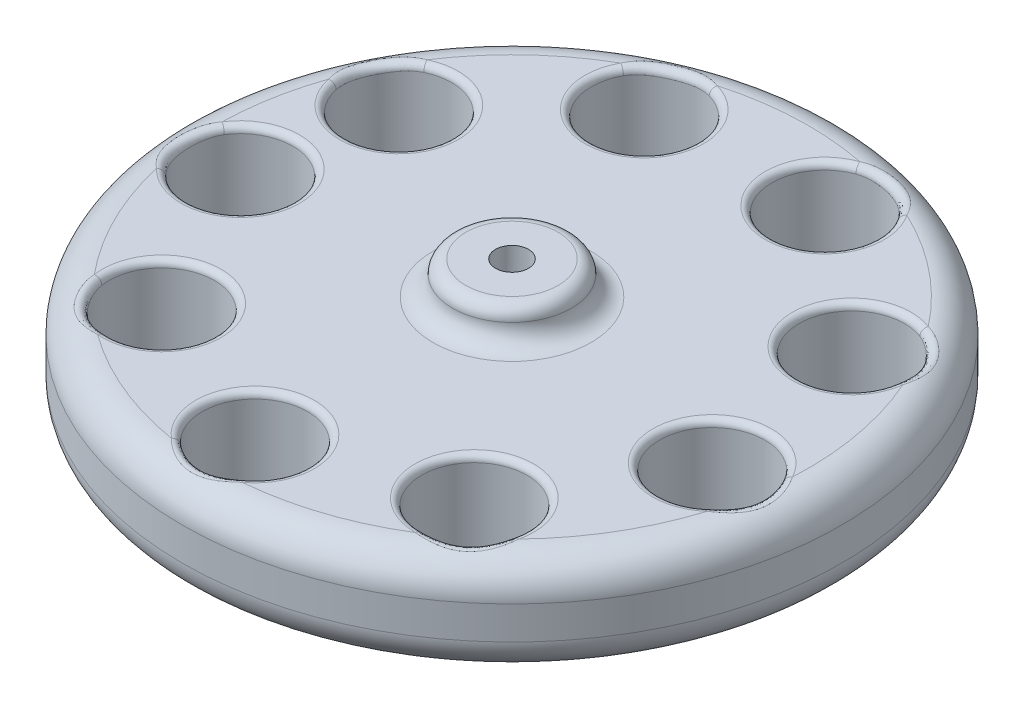
from build123d import *

# Parameters (mm, degrees)
SKETCH1_R               = 50
BOSS_EXTRUDE1_DEPTH     = 15
SKETCH2_R               = 8
CUT_EXTRUDE1_DEPTH      = 20
CIRPATTERN1_COUNT       = 9
CIRPATTERN1_ANGLE       = 328
FILLET1_R               = 5
SKETCH3_R               = 9
BOSS_EXTRUDE2_DEPTH     = 5
CUT_EXTRUDE2_DEPTH      = 74.48469242
CUT_EXTRUDE2_DEPTH_BACK = 74.48469242
SKETCH4_R               = 2.5
FILLET2_R               = 3
FILLET3_R               = 2
FILLET4_R               = 1
SKETCH5_R               = 6
BOSS_EXTRUDE3_DEPTH     = 3
FILLET7_R               = 2
CUT_EXTRUDE3_DEPTH      = 3


# Some blends are built 0.0001 mm under size
with BuildPart() as part:
    # Sketch1 → Boss-Extrude1 (new body)
    with BuildSketch(Plane(origin=(0, 0, 0), x_dir=(1, 0, 0), z_dir=(0, 1, 0))):
        with Locations(Location((0, 0, 0), (0, 0, 270))):
            Circle(SKETCH1_R)
    extrude(amount=BOSS_EXTRUDE1_DEPTH)

    # Sketch2 → Cut-Extrude1 (cut)
    with BuildSketch(Plane(origin=(0, 0, 0), x_dir=(1, 0, 0), z_dir=(0, 1, 0))):
        with Locations(Location((-33.744536775, 16.580107896, 0), (0, 0, 270))):
            Circle(SKETCH2_R)
    cut_extrude1 = extrude(amount=CUT_EXTRUDE1_DEPTH, mode=Mode.SUBTRACT)

    # CirPattern1: Cut-Extrude1 ×9 about axis
    cirpattern1_axis = Axis((0, 0, 0), (0, -1, 0))
    for i in range(1, CIRPATTERN1_COUNT):
        add(cut_extrude1.rotate(cirpattern1_axis, i * CIRPATTERN1_ANGLE / (CIRPATTERN1_COUNT - 1)), mode=Mode.SUBTRACT)

    # Fillet1
    # the kernel refuses this fillet: 5 mm, written as the material it takes off along each edge
    with BuildSketch(Plane(origin=(0, 0, 0), x_dir=(0, 0, 1), z_dir=(-1, 0, 0))) as fillet1_piece_1:
        with BuildLine():
            CenterArc((50 - FILLET1_R, FILLET1_R), FILLET1_R, 270, 90)
            Line((50 - FILLET1_R, 0), (50, 0))
            Line((50, 0), (50, FILLET1_R))
        make_face()
    revolve(axis=Axis((0, 0, 0), (0, 1, 0)), mode=Mode.SUBTRACT)
    with BuildSketch(Plane(origin=(0, 15, 0), x_dir=(0, 0, 1), z_dir=(-1, 0, 0))) as fillet1_piece_2:
        with BuildLine():
            CenterArc((50 - FILLET1_R, -FILLET1_R), FILLET1_R, 0, 90)
            Line((50 - FILLET1_R, 0), (50, 0))
            Line((50, 0), (50, -FILLET1_R))
        make_face()
    revolve(axis=Axis((0, 15, 0), (0, 1, 0)), mode=Mode.SUBTRACT)

    # Sketch3 → Boss-Extrude2 (add)
    with BuildSketch(Plane(origin=(0, 15, 0), x_dir=(1, 0, 0), z_dir=(0, 1, 0))):
        with Locations(Location((0, 0, 0), (0, 0, 270))):
            Circle(SKETCH3_R)
    extrude(amount=BOSS_EXTRUDE2_DEPTH)

    # Sketch4 → Cut-Extrude2 (cut, two sides: drawn at the far end of the back side and taken through both)
    with BuildSketch(Plane(origin=(0, 0, 0), x_dir=(1, 0, 0), z_dir=(0, 1, 0)).offset(-CUT_EXTRUDE2_DEPTH_BACK)):
        with Locations(Location((0, 0, 0), (0, 0, 270))):
            Circle(SKETCH4_R)
    extrude(amount=CUT_EXTRUDE2_DEPTH + CUT_EXTRUDE2_DEPTH_BACK, mode=Mode.SUBTRACT)

    # Fillet2
    fillet2_edges = [part.edges().sort_by_distance(p)[0] for p in [
        (0, 15, -9),
    ]]
    fillet(fillet2_edges, radius=FILLET2_R)

    # Fillet3
    fillet3_edges = [part.edges().sort_by_distance(p)[0] for p in [
        (0, 20, -9),
    ]]
    fillet(fillet3_edges, radius=FILLET3_R - 0.0001)  # a hair under: the kernel refuses the full size

    # Fillet4
    fillet4_edges = [part.edges().sort_by_distance(p)[0] for p in [
        (-6.945294876, 15, 31.784010066),
        (30.438992472, 0, -11.485998173),
        (30.50809204, 0, 11.301182985),
        (15.610506201, 0, 28.544220306),
        (-6.945294876, 0, 31.784010066),
        (-26.093867361, 0, 19.431173482),
        (-32.441288489, 0, -2.454224502),
        (-7.137928256, 0, -31.741304273),
        (-26.211232098, 0, -19.272564143),
        (30.50809204, 15, 11.301182985),
        (44.881811578, 14.964136203, 8.048686472),
        (44.881811579, 0.035863797, 8.048686471),
        (15.610506201, 15, 28.544220306),
        (28.592319744, 14.964136203, 35.519538512),
        (28.592319746, 0.035863797, 35.519538511),
        (-2.564706279, 14.96842246, 45.488808024),
        (-2.564706279, 0.031577554, 45.488808026),
        (-26.093867361, 15, 19.431173482),
        (-31.194583002, 14.964136203, 33.257425574),
        (-31.194583001, 0.035863797, 33.257425575),
        (-32.441288489, 15, -2.454224502),
        (-45.361684972, 14.964136203, 4.63420986),
        (-45.361684971, 0.035863797, 4.634209861),
        (-26.211232098, 15, -19.272564143),
        (-40.924647658, 14.964136203, -20.107997876),
        (-40.924647658, 0.035863797, -20.107997875),
        (-7.137928256, 15, -31.741304273),
        (-17.694190093, 14.964136203, -42.02468324),
        (-17.694190094, 0.035863797, -42.024683239),
        (15.437106423, 15, -28.638368704),
        (14.216698103, 14.964136203, -43.324864218),
        (30.438992472, 15, -11.485998173),
        (39.153146607, 14.964136203, -23.370696935),
        (39.153146607, 0.035863797, -23.370696936),
    ]]
    fillet(fillet4_edges, radius=FILLET4_R)

    # Sketch5 → Boss-Extrude3 (add)
    with BuildSketch(Plane(origin=(0, 0, 0), x_dir=(1, 0, 0), z_dir=(0, 1, 0))):
        with Locations(Location((0, 0, 0), (0, 0, 270))):
            Circle(SKETCH5_R)
    extrude(amount=-BOSS_EXTRUDE3_DEPTH)

    # Fillet7
    fillet7_edges = [part.edges().sort_by_distance(p)[0] for p in [
        (0, -3, -6),
    ]]
    fillet(fillet7_edges, radius=FILLET7_R)

    # Sketch6 → Cut-Extrude3 (cut)
    # profile 1 of 9: a face of its own
    with BuildSketch(Plane(origin=(0, 0, 0), x_dir=(-1, 0, 0), z_dir=(0, -1, 0))):
        Polygon((-8.335257714, 25.690686596), (-6.574124902, 25.690686596), (-6.574124902, 16.165686596), (-7.428932594, 16.165686596), (-7.428932594, 24.713763519), (-8.894317209, 24.713763519), align=None)
    # profile 2 of 9: a face of its own
    with BuildSketch(Plane(origin=(0, 0, 0), x_dir=(-1, 0, 0), z_dir=(0, -1, 0))):
        with BuildLine():
            Line((-21.550117783, 14.945225267), (-22.404925475, 14.945225267))
            add(Edge.make_bspline(
                [(-22.404925475, 14.945225267), (-22.399354294, 15.058629611), (-22.388412644, 15.281352726), (-22.337172799, 15.606084214), (-22.263855126, 15.916476202), (-22.160191955, 16.210036468), (-22.031451299, 16.489360651), (-21.877064582, 16.753339265), (-21.694201317, 17.000965285), (-21.486810134, 17.229943138), (-21.261561195, 17.440003598), (-21.018521459, 17.62140108), (-20.763128921, 17.7746656), (-20.496158414, 17.902793837), (-20.21459788, 17.998968703), (-19.921002388, 18.070329023), (-19.614082024, 18.113263221), (-19.404967393, 18.11787818), (-19.298615379, 18.120225267)],
                knots=[0, 0, 0, 0, 1.10065271, 2.161652631, 3.183658789, 4.190468796, 5.17591951, 6.163126047, 7.15150782, 8.156236427, 9.156009102, 10.134482811, 11.092018607, 12.041330605, 13.001268258, 13.972401359, 14.968799086, 16, 16, 16, 16], degree=3))
            add(Edge.make_bspline(
                [(-19.298615379, 18.120225267), (-19.194172191, 18.117780182), (-18.988945059, 18.112975677), (-18.689419148, 18.071716019), (-18.404275226, 18.007094087), (-18.134070661, 17.916428562), (-17.8809613, 17.794550941), (-17.643045728, 17.648144783), (-17.417491522, 17.478817956), (-17.214454489, 17.279462935), (-17.028014645, 17.066640731), (-16.867172079, 16.839434365), (-16.72943197, 16.604767523), (-16.614621213, 16.360850775), (-16.530104149, 16.105387476), (-16.46593774, 15.842096874), (-16.429668135, 15.568253638), (-16.424101662, 15.382906512), (-16.421271629, 15.288674786)],
                knots=[0, 0, 0, 0, 1.111607364, 2.184268762, 3.212621178, 4.221274766, 5.211760367, 6.196651075, 7.1921475, 8.207485113, 9.220403448, 10.201281604, 11.166441695, 12.114753415, 13.065576456, 14.026450734, 14.996634279, 16, 16, 16, 16], degree=3))
            add(Edge.make_bspline(
                [(-16.421271629, 15.288674786), (-16.425879723, 15.156011036), (-16.435015045, 14.893011598), (-16.51315917, 14.506528293), (-16.635205746, 14.132077631), (-16.782155696, 13.830713973), (-16.930398562, 13.587871393), (-17.063986707, 13.387931561), (-17.220373086, 13.172651679), (-17.401833855, 12.942752639), (-17.604615315, 12.696433676), (-17.830554202, 12.43384359), (-18.081261678, 12.157695417), (-18.257225169, 11.969085173), (-18.348405042, 11.87135207)],
                knots=[0, 0, 0, 0, 1.184426356, 2.348067706, 3.509069118, 4.696110526, 5.333549288, 6.050745305, 6.844228056, 7.710549037, 8.667450064, 9.695053472, 10.805634456, 12, 12, 12, 12], degree=3))
            Line((-18.348405042, 11.87135207), (-20.731563095, 9.327917575))
            Line((-20.731563095, 9.327917575), (-16.299156244, 9.327917575))
            Line((-16.299156244, 9.327917575), (-16.299156244, 8.350994498))
            Line((-16.299156244, 8.350994498), (-22.771271629, 8.350994498))
            Line((-22.771271629, 8.350994498), (-19.077281244, 12.293031757))
            add(Edge.make_bspline(
                [(-19.077281244, 12.293031757), (-18.987343781, 12.386916434), (-18.81459232, 12.567249685), (-18.57025545, 12.830528741), (-18.350802203, 13.074775705), (-18.154812013, 13.299529098), (-17.986536545, 13.508076436), (-17.837205685, 13.693663451), (-17.717556469, 13.864445205), (-17.587702428, 14.06240359), (-17.461934379, 14.304099967), (-17.353860039, 14.59946665), (-17.287961058, 14.903524388), (-17.280055756, 15.108997789), (-17.276079321, 15.212352671)],
                knots=[0, 0, 0, 0, 1.329631726, 2.553950428, 3.673215718, 4.687767853, 5.603093632, 6.413772471, 7.123043292, 7.734684054, 8.834405432, 9.900288307, 10.943827018, 12, 12, 12, 12], degree=3))
            add(Edge.make_bspline(
                [(-17.276079321, 15.212352671), (-17.277809448, 15.277344191), (-17.281219197, 15.405429996), (-17.311311931, 15.593224241), (-17.356788379, 15.774375627), (-17.421953689, 15.949441369), (-17.507969174, 16.116661322), (-17.61267173, 16.276239036), (-17.733476117, 16.430514005), (-17.873224928, 16.575166909), (-18.02674485, 16.707649333), (-18.188926343, 16.825008451), (-18.360512699, 16.923086317), (-18.54078046, 17.003486834), (-18.729227059, 17.066556979), (-18.926216972, 17.110259256), (-19.131205902, 17.137698015), (-19.271178487, 17.141410512), (-19.342500595, 17.14330219)],
                knots=[0, 0, 0, 0, 0.991446411, 1.95395049, 2.89581595, 3.838931463, 4.798493298, 5.75982156, 6.748411868, 7.785213223, 8.824556874, 9.840280684, 10.836137867, 11.835679398, 12.848801643, 13.863922112, 14.911575587, 16, 16, 16, 16], degree=3))
            add(Edge.make_bspline(
                [(-19.342500595, 17.14330219), (-19.416988361, 17.141356281), (-19.563270035, 17.137534836), (-19.778042546, 17.110803158), (-19.982927412, 17.064686264), (-20.17844002, 17.0016126), (-20.364911178, 16.921443263), (-20.541434041, 16.821589301), (-20.707612332, 16.702435652), (-20.863758442, 16.567342424), (-21.007623985, 16.416935595), (-21.13402584, 16.249268481), (-21.244472336, 16.067402443), (-21.340836036, 15.871828202), (-21.419092592, 15.660771129), (-21.478890952, 15.434980447), (-21.526208013, 15.195436545), (-21.542015487, 15.030014278), (-21.550117783, 14.945225267)],
                knots=[0, 0, 0, 0, 1.031018746, 2.02475058, 2.990194455, 3.934040569, 4.864654155, 5.795059489, 6.735614925, 7.690564532, 8.649604399, 9.611025574, 10.590972636, 11.591080095, 12.624614302, 13.701020113, 14.821632451, 16, 16, 16, 16], degree=3))
        make_face()
    # profile 3 of 9: a face of its own
    with BuildSketch(Plane(origin=(0, 0, 0), x_dir=(-1, 0, 0), z_dir=(0, -1, 0))):
        with BuildLine():
            Line((-25.227619947, -3.01605176), (-26.082427639, -3.01605176))
            add(Edge.make_bspline(
                [(-26.082427639, -3.01605176), (-26.059269505, -2.920169071), (-26.013997246, -2.732726258), (-25.919570278, -2.464917926), (-25.816702305, -2.211488915), (-25.693179099, -1.9771846), (-25.558444561, -1.757296157), (-25.404077726, -1.556810897), (-25.237200481, -1.370629898), (-25.052619726, -1.205403159), (-24.859048154, -1.055785196), (-24.653758225, -0.928218075), (-24.440880207, -0.818478774), (-24.218939181, -0.728072286), (-23.987274385, -0.65996711), (-23.747980196, -0.610554661), (-23.500429528, -0.578465986), (-23.33238787, -0.575334266), (-23.247061052, -0.573744067)],
                knots=[0, 0, 0, 0, 1.162005537, 2.271625781, 3.343758855, 4.383309926, 5.390229558, 6.379919256, 7.361854164, 8.333198761, 9.295911338, 10.242430842, 11.177959212, 12.116337295, 13.062827104, 14.020064771, 14.994644689, 16, 16, 16, 16], degree=3))
            add(Edge.make_bspline(
                [(-23.247061052, -0.573744067), (-23.122738733, -0.577497544), (-22.876805925, -0.584922623), (-22.515500775, -0.652725482), (-22.167084932, -0.760018164), (-21.83537205, -0.908264521), (-21.527256173, -1.091109995), (-21.253109836, -1.308728315), (-21.016648961, -1.556920699), (-20.818272118, -1.831057178), (-20.662946585, -2.124033957), (-20.548411526, -2.42556867), (-20.478683951, -2.734946035), (-20.469647293, -2.943835488), (-20.465119947, -3.048488659)],
                knots=[0, 0, 0, 0, 1.083050992, 2.142477498, 3.193116406, 4.255571735, 5.30263384, 6.308962982, 7.297363603, 8.282367274, 9.249857812, 10.179914175, 11.08814088, 12, 12, 12, 12], degree=3))
            add(Edge.make_bspline(
                [(-20.465119947, -3.048488659), (-20.468286577, -3.149200007), (-20.47448318, -3.346276487), (-20.527098479, -3.63398999), (-20.615643594, -3.905157488), (-20.738297734, -4.160920508), (-20.897070095, -4.399657394), (-21.089400792, -4.621905282), (-21.316647321, -4.82864992), (-21.488856431, -4.947085057), (-21.577514778, -5.008058971)],
                knots=[0, 0, 0, 0, 1.024540389, 2.004866551, 2.965041327, 3.920577974, 4.882998113, 5.874504559, 6.905732034, 8, 8, 8, 8], degree=3))
            add(Edge.make_bspline(
                [(-21.577514778, -5.008058971), (-21.476191218, -5.056985281), (-21.275439938, -5.153922451), (-21.001798855, -5.344029906), (-20.753392637, -5.563530394), (-20.614861801, -5.734824328), (-20.545258168, -5.8208895)],
                knots=[0, 0, 0, 0, 1.015518401, 2.012035669, 3.001164323, 4, 4, 4, 4], degree=3))
            add(Edge.make_bspline(
                [(-20.545258168, -5.8208895), (-20.499425658, -5.883639524), (-20.408511176, -6.008111997), (-20.296291616, -6.208236127), (-20.194485384, -6.410578395), (-20.115155144, -6.620562207), (-20.053721978, -6.835753766), (-20.009808919, -7.056522572), (-19.982528935, -7.283048904), (-19.978622183, -7.436299297), (-19.976658408, -7.513332409)],
                knots=[0, 0, 0, 0, 1.025084078, 2.033381695, 3.024893161, 4.013698104, 4.991890475, 5.976764909, 6.982997093, 8, 8, 8, 8], degree=3))
            add(Edge.make_bspline(
                [(-19.976658408, -7.513332409), (-19.981542049, -7.646708864), (-19.991286347, -7.912834104), (-20.078383149, -8.306011739), (-20.21340204, -8.690346856), (-20.405145558, -9.057943383), (-20.63882785, -9.401878562), (-20.916841711, -9.70960766), (-21.236028294, -9.974126719), (-21.592006524, -10.195134554), (-21.977679567, -10.371804043), (-22.390181713, -10.494424655), (-22.82356936, -10.574287697), (-23.12076922, -10.582851676), (-23.27186574, -10.587205606)],
                knots=[0, 0, 0, 0, 0.955779014, 1.907060117, 2.875433937, 3.871313158, 4.872415639, 5.851225146, 6.836215519, 7.83643374, 8.849228613, 9.86973379, 10.916971861, 12, 12, 12, 12], degree=3))
            add(Edge.make_bspline(
                [(-23.27186574, -10.587205606), (-23.373699693, -10.584842825), (-23.574074955, -10.580193662), (-23.868651904, -10.548411183), (-24.149834528, -10.490363097), (-24.418003005, -10.412249102), (-24.673395569, -10.313211575), (-24.915232884, -10.189879975), (-25.145002808, -10.04479653), (-25.360537097, -9.876248695), (-25.561810056, -9.687704478), (-25.743472827, -9.475816743), (-25.90855412, -9.24450238), (-26.05263373, -8.991074634), (-26.182274294, -8.718808612), (-26.288902469, -8.424218056), (-26.382752481, -8.109936539), (-26.426386408, -7.890922118), (-26.448773793, -7.77855176)],
                knots=[0, 0, 0, 0, 1.048658725, 2.063410685, 3.046034179, 4.001477787, 4.936774919, 5.862367409, 6.792675028, 7.730719943, 8.675894397, 9.627829632, 10.600096036, 11.597688215, 12.626045268, 13.701542398, 14.82072376, 16, 16, 16, 16], degree=3))
            Line((-26.448773793, -7.77855176), (-25.593966101, -7.77855176))
            add(Edge.make_bspline(
                [(-25.593966101, -7.77855176), (-25.571695857, -7.851891574), (-25.5283783, -7.994543884), (-25.454643103, -8.199849288), (-25.370637306, -8.38805799), (-25.2805184, -8.560550629), (-25.185871343, -8.719025952), (-25.079967154, -8.859293467), (-24.970649695, -8.987514125), (-24.888246597, -9.05975339), (-24.847917423, -9.09510825)],
                knots=[0, 0, 0, 0, 1.198163088, 2.33053128, 3.407730985, 4.417276592, 5.372219308, 6.28897303, 7.162600585, 8, 8, 8, 8], degree=3))
            add(Edge.make_bspline(
                [(-24.847917423, -9.09510825), (-24.794586739, -9.136224502), (-24.688089993, -9.218330088), (-24.514549306, -9.32310952), (-24.332037009, -9.413899168), (-24.136598503, -9.483251225), (-23.932451163, -9.541973288), (-23.716295262, -9.580401272), (-23.490037822, -9.606766938), (-23.335548408, -9.609093573), (-23.256601317, -9.610282529)],
                knots=[0, 0, 0, 0, 0.946170439, 1.889420265, 2.845303464, 3.807233317, 4.801018734, 5.828864929, 6.890507805, 8, 8, 8, 8], degree=3))
            add(Edge.make_bspline(
                [(-23.256601317, -9.610282529), (-23.167464999, -9.608606387), (-22.993166624, -9.605328835), (-22.7388359, -9.57518709), (-22.496880632, -9.531289322), (-22.26998717, -9.463490419), (-22.055183432, -9.379722531), (-21.855480514, -9.274543656), (-21.668256825, -9.151141235), (-21.495910371, -9.010881096), (-21.34093724, -8.857334027), (-21.204486136, -8.696734169), (-21.088486165, -8.529758662), (-20.994913713, -8.35548349), (-20.921025429, -8.174630331), (-20.870724719, -7.98669166), (-20.835750239, -7.793205528), (-20.832901959, -7.661681692), (-20.831466101, -7.595378683)],
                knots=[0, 0, 0, 0, 1.217147791, 2.380027433, 3.494444702, 4.572153297, 5.609568379, 6.639424714, 7.649109417, 8.668170816, 9.669597737, 10.625200337, 11.543417969, 12.441394052, 13.322311151, 14.205496177, 15.095365482, 16, 16, 16, 16], degree=3))
            add(Edge.make_bspline(
                [(-20.831466101, -7.595378683), (-20.835630707, -7.506629253), (-20.843939197, -7.329571999), (-20.907371831, -7.069083458), (-21.011708311, -6.818104028), (-21.157774217, -6.580915771), (-21.335580736, -6.361089925), (-21.543402375, -6.164952533), (-21.782964911, -6.003108928), (-22.003454697, -5.891289085), (-22.198758445, -5.814988187), (-22.365896027, -5.764165606), (-22.553012212, -5.721129871), (-22.757844204, -5.681091475), (-22.981935386, -5.647015521), (-23.225041792, -5.618598865), (-23.487212686, -5.595861218), (-23.66870793, -5.585707308), (-23.762235331, -5.580474837)],
                knots=[0, 0, 0, 0, 1.07054697, 2.135767047, 3.216561865, 4.33974944, 5.486079747, 6.621378074, 7.775625952, 8.963672916, 9.598146892, 10.304877434, 11.070270905, 11.915000392, 12.823868403, 13.805723172, 14.86925407, 16, 16, 16, 16], degree=3))
            Line((-23.762235331, -5.580474837), (-23.762235331, -4.60355176))
            add(Edge.make_bspline(
                [(-23.762235331, -4.60355176), (-23.644394302, -4.601552044), (-23.413572673, -4.597635092), (-23.076403172, -4.550260435), (-22.753986515, -4.484726726), (-22.453468025, -4.38434631), (-22.179559741, -4.267759502), (-21.941925681, -4.132090274), (-21.743895087, -3.981282992), (-21.586430314, -3.813009963), (-21.467968627, -3.632538298), (-21.381354271, -3.444442251), (-21.330190526, -3.247073199), (-21.323360647, -3.112376996), (-21.319927639, -3.044672553)],
                knots=[0, 0, 0, 0, 1.321986639, 2.589447074, 3.816329219, 5.01088745, 6.139805852, 7.153945165, 8.075214402, 8.924034688, 9.728124013, 10.488707548, 11.240355623, 12, 12, 12, 12], degree=3))
            add(Edge.make_bspline(
                [(-21.319927639, -3.044672553), (-21.321055429, -2.994930975), (-21.323299113, -2.895972465), (-21.351594562, -2.751396385), (-21.394114274, -2.61124024), (-21.452569823, -2.476100056), (-21.530811435, -2.346913096), (-21.62444487, -2.222577967), (-21.735936628, -2.10380454), (-21.863695309, -1.993095956), (-22.000887435, -1.887588247), (-22.151245752, -1.798016134), (-22.310236711, -1.721421358), (-22.478036336, -1.658258356), (-22.655189172, -1.61074415), (-22.840862875, -1.576628754), (-23.0354115, -1.555299136), (-23.168140285, -1.552228233), (-23.235612735, -1.550667144)],
                knots=[0, 0, 0, 0, 0.884392785, 1.759457502, 2.611959086, 3.489218968, 4.37281399, 5.2945488, 6.255912374, 7.266815255, 8.301784654, 9.332968512, 10.37626691, 11.440494194, 12.520033166, 13.637162961, 14.798855837, 16, 16, 16, 16], degree=3))
            add(Edge.make_bspline(
                [(-23.235612735, -1.550667144), (-23.344066203, -1.554453637), (-23.55590105, -1.561849537), (-23.861285931, -1.626627738), (-24.145183547, -1.729982379), (-24.362186633, -1.853352953), (-24.522431353, -1.975138063), (-24.636940734, -2.081497986), (-24.749391552, -2.199697313), (-24.852385858, -2.337016177), (-24.956545752, -2.484155085), (-25.051372737, -2.648593818), (-25.143519471, -2.82604292), (-25.199043553, -2.951488896), (-25.227619947, -3.01605176)],
                knots=[0, 0, 0, 0, 1.472543308, 2.876219568, 4.221790263, 5.565193594, 6.249813518, 6.953379497, 7.687249741, 8.463570142, 9.283606569, 10.136032583, 11.040678096, 12, 12, 12, 12], degree=3))
        make_face()
    # profile 4 of 9: a face of its own
    with BuildSketch(Plane(origin=(0, 0, 0), x_dir=(-1, 0, 0), z_dir=(0, -1, 0))):
        Polygon((-12.208803529, -12.219167587), (-12.035170716, -12.219167587), (-12.035170716, -18.813398356), (-10.936132255, -18.813398356), (-10.936132255, -19.790321433), (-12.035170716, -19.790321433), (-12.035170716, -21.988398356), (-12.889978409, -21.988398356), (-12.889978409, -19.790321433), (-17.408247639, -19.790321433), align=None)
        Polygon((-12.889978409, -18.813398356), (-12.889978409, -14.676739702), (-15.729161101, -18.813398356), align=None, mode=Mode.SUBTRACT)
    # profile 5 of 9: a face of its own
    with BuildSketch(Plane(origin=(0, 0, 0), x_dir=(-1, 0, 0), z_dir=(0, -1, 0))):
        with BuildLine():
            Line((3.745102634, -16.447359034), (3.745102634, -17.424282111))
            Line((3.745102634, -17.424282111), (0.505228836, -17.424282111))
            Line((0.505228836, -17.424282111), (-0.00803739, -19.929555548))
            add(Edge.make_bspline(
                [(-0.00803739, -19.929555548), (0.092807525, -19.901714594), (0.288178599, -19.847777149), (0.576540792, -19.787890017), (0.850295288, -19.751789059), (1.027937546, -19.746859706), (1.113897706, -19.744474419)],
                knots=[0, 0, 0, 0, 1.100273476, 2.13160584, 3.095893838, 4, 4, 4, 4], degree=3))
            add(Edge.make_bspline(
                [(1.113897706, -19.744474419), (1.220261312, -19.746776572), (1.429398736, -19.751303181), (1.735393299, -19.794769429), (2.027492101, -19.863185911), (2.305084266, -19.958763902), (2.568683336, -20.080982533), (2.815864056, -20.233654514), (3.050336663, -20.411998793), (3.267894722, -20.617044862), (3.465264446, -20.842710119), (3.638799032, -21.085346896), (3.786198653, -21.342597177), (3.904746136, -21.616918833), (3.999409217, -21.905279101), (4.062415717, -22.210712058), (4.10437119, -22.530338727), (4.109058541, -22.748881879), (4.111448788, -22.860324779)],
                knots=[0, 0, 0, 0, 1.052922333, 2.070308379, 3.05430497, 4.020497103, 4.973039431, 5.925935799, 6.892292201, 7.88610001, 8.88166317, 9.857072816, 10.836096531, 11.812156883, 12.81219415, 13.836441305, 14.89672472, 16, 16, 16, 16], degree=3))
            add(Edge.make_bspline(
                [(4.111448788, -22.860324779), (4.109638833, -22.937945965), (4.106043383, -23.092139352), (4.087759227, -23.321131784), (4.052555599, -23.545276351), (4.005290579, -23.764602789), (3.943942998, -23.978695866), (3.869677787, -24.188168382), (3.778792884, -24.391716561), (3.679103213, -24.591266386), (3.566853869, -24.782306609), (3.442270931, -24.960965637), (3.310647701, -25.129923575), (3.169020788, -25.287368377), (3.016073794, -25.432265447), (2.853659027, -25.565474699), (2.683072485, -25.68924889), (2.501675004, -25.798563764), (2.313508675, -25.899155809), (2.11585617, -25.98167915), (1.913216692, -26.055458516), (1.70267371, -26.114267302), (1.48470412, -26.160348039), (1.258948623, -26.191646102), (1.026591229, -26.214441979), (0.869088516, -26.215868979), (0.789528715, -26.216589803)],
                knots=[0, 0, 0, 0, 1.056347294, 2.098418968, 3.122841568, 4.141288669, 5.149314143, 6.15115421, 7.162517403, 8.180376062, 9.185164535, 10.17417709, 11.141909838, 12.097768115, 13.052685741, 14.0056014, 14.954263652, 15.917497458, 16.885230207, 17.854509472, 18.828990115, 19.81800267, 20.826176721, 21.857883937, 22.917946725, 24, 24, 24, 24], degree=3))
            add(Edge.make_bspline(
                [(0.789528715, -26.216589803), (0.694621124, -26.214709737), (0.507901649, -26.211010929), (0.234342105, -26.172316337), (-0.028859786, -26.116897393), (-0.279585275, -26.033522973), (-0.520081357, -25.929054692), (-0.747110325, -25.797021397), (-0.966473187, -25.647399693), (-1.169252373, -25.470832447), (-1.357455796, -25.277840484), (-1.525929938, -25.06840576), (-1.675972029, -24.845984921), (-1.805179326, -24.609497802), (-1.915391798, -24.3595658), (-2.001974016, -24.095252491), (-2.071855825, -23.817938908), (-2.101419848, -23.627021141), (-2.116435828, -23.530051342)],
                knots=[0, 0, 0, 0, 1.0467383, 2.05933395, 3.04377827, 4.011590433, 4.970194871, 5.932262533, 6.905835911, 7.896367577, 8.894135286, 9.877477877, 10.858688626, 11.851381753, 12.8477658, 13.868841284, 14.917554742, 16, 16, 16, 16], degree=3))
            Line((-2.116435828, -23.530051342), (-1.261628135, -23.530051342))
            add(Edge.make_bspline(
                [(-1.261628135, -23.530051342), (-1.240595419, -23.620882973), (-1.200169369, -23.795466412), (-1.111435153, -24.040752419), (-1.00294302, -24.25933545), (-0.873935472, -24.454106958), (-0.720038603, -24.623948587), (-0.544426372, -24.775306448), (-0.347537211, -24.911854479), (-0.128752779, -25.025672152), (0.102059958, -25.122742117), (0.34363358, -25.187380658), (0.589390409, -25.232830945), (0.75561083, -25.237380523), (0.83913809, -25.239666726)],
                knots=[0, 0, 0, 0, 1.136247022, 2.183929868, 3.172523383, 4.106158343, 5.02341133, 5.958108904, 6.928429099, 7.938127109, 8.96079061, 9.975095812, 10.982467395, 12, 12, 12, 12], degree=3))
            add(Edge.make_bspline(
                [(0.83913809, -25.239666726), (0.920667857, -25.237433038), (1.081200635, -25.233034887), (1.317451623, -25.199183004), (1.545542373, -25.147047042), (1.763222251, -25.06902408), (1.974300441, -24.974196668), (2.173437631, -24.852507783), (2.366394746, -24.712463018), (2.547174167, -24.552016761), (2.712744382, -24.375206377), (2.859037826, -24.186128614), (2.980894998, -23.98442491), (3.08358568, -23.773587258), (3.161563586, -23.551304899), (3.217192256, -23.318619558), (3.249857723, -23.074956505), (3.254351292, -22.90876074), (3.256641095, -22.824071774)],
                knots=[0, 0, 0, 0, 1.027316725, 2.022795036, 3.002884548, 3.971462791, 4.93288096, 5.914575861, 6.907176829, 7.935150275, 8.956128384, 9.956726525, 10.942570165, 11.921478529, 12.907843606, 13.90538589, 14.932640048, 16, 16, 16, 16], degree=3))
            add(Edge.make_bspline(
                [(3.256641095, -22.824071774), (3.25484909, -22.747665622), (3.251341496, -22.598111449), (3.222683301, -22.379310752), (3.172834969, -22.172283401), (3.103645696, -21.976029664), (3.015799321, -21.790364439), (2.908449, -21.615096111), (2.77958011, -21.452534751), (2.632372899, -21.302604301), (2.471106373, -21.164233606), (2.293005902, -21.046275771), (2.10179853, -20.947041823), (1.899787977, -20.861403914), (1.682169217, -20.799897599), (1.453251811, -20.753720711), (1.21056377, -20.727008903), (1.044636397, -20.723302621), (0.959345422, -20.721397496)],
                knots=[0, 0, 0, 0, 1.045622112, 2.046656509, 3.013763289, 3.955457236, 4.890082067, 5.820317437, 6.762574623, 7.722996705, 8.69280354, 9.665887285, 10.63943826, 11.638615906, 12.663482002, 13.728887084, 14.832589034, 16, 16, 16, 16], degree=3))
            add(Edge.make_bspline(
                [(0.959345422, -20.721397496), (0.88551598, -20.722977533), (0.733076913, -20.726239909), (0.499244078, -20.75026059), (0.253521603, -20.789011813), (-0.00314856, -20.842314386), (-0.271537228, -20.912067531), (-0.551078019, -20.99565485), (-0.842358687, -21.095591147), (-1.038621923, -21.171062386), (-1.139512751, -21.209859034)],
                knots=[0, 0, 0, 0, 0.817624296, 1.688186739, 2.600797293, 3.572016777, 4.590301741, 5.671205678, 6.80286297, 8, 8, 8, 8], degree=3))
            Line((-1.139512751, -21.209859034), (-0.162589674, -16.447359034))
            Line((-0.162589674, -16.447359034), (3.745102634, -16.447359034))
        make_face()
    # profile 6 of 9: a face of its own
    with BuildSketch(Plane(origin=(0, 0, 0), x_dir=(-1, 0, 0), z_dir=(0, -1, 0))):
        with BuildLine():
            Line((16.254694263, -10.533645762), (16.912972508, -11.050728094))
            Line((16.912972508, -11.050728094), (14.396250753, -14.899270762))
            add(Edge.make_bspline(
                [(14.396250753, -14.899270762), (14.563809864, -14.872563041), (14.890652855, -14.820466612), (15.221485765, -14.811872489), (15.382714095, -14.807684223)],
                knots=[0, 0, 0, 0, 1.025318673, 2, 2, 2, 2], degree=3))
            add(Edge.make_bspline(
                [(15.382714095, -14.807684223), (15.479522102, -14.810286213), (15.670085785, -14.815408152), (15.949867154, -14.854824917), (16.218714187, -14.916941829), (16.475512574, -15.007489897), (16.721184047, -15.123157019), (16.957138424, -15.261783516), (17.178940323, -15.430527546), (17.389446033, -15.619027175), (17.580564062, -15.827806969), (17.749771756, -16.049334892), (17.891903239, -16.283380147), (18.00722084, -16.529824189), (18.096769117, -16.788287131), (18.162049779, -17.058438283), (18.200638529, -17.34046393), (18.205878614, -17.53226525), (18.208540417, -17.62969444)],
                knots=[0, 0, 0, 0, 1.04369286, 2.054478336, 3.041073146, 4.015093852, 4.984733326, 5.965804835, 6.960378782, 7.985147595, 9.009457201, 10.008161701, 10.986880575, 11.956520048, 12.937015923, 13.931873656, 14.949455224, 16, 16, 16, 16], degree=3))
            add(Edge.make_bspline(
                [(18.208540417, -17.62969444), (18.204667538, -17.762989205), (18.19704663, -18.025281759), (18.121108443, -18.407306939), (18.003108267, -18.771250427), (17.83444085, -19.111301558), (17.624938794, -19.426994265), (17.369457631, -19.706717568), (17.077057852, -19.956191026), (16.746440208, -20.16480654), (16.39063257, -20.335176272), (16.01683892, -20.457545966), (15.628689329, -20.532884551), (15.365242503, -20.542329548), (15.231977917, -20.5471073)],
                knots=[0, 0, 0, 0, 1.031375318, 2.029502543, 3.004789286, 3.987476834, 4.960371455, 5.9300674, 6.912260825, 7.929083631, 8.949397511, 9.960523116, 10.96833055, 12, 12, 12, 12], degree=3))
            add(Edge.make_bspline(
                [(15.231977917, -20.5471073), (15.10380761, -20.542948398), (14.849924673, -20.534710339), (14.476455426, -20.461324465), (14.117599643, -20.342378707), (13.775871542, -20.178509849), (13.459313303, -19.971523753), (13.176106106, -19.722343551), (12.927662063, -19.43629565), (12.720902559, -19.113424419), (12.556912724, -18.766469606), (12.43393157, -18.40469063), (12.36209608, -18.02940568), (12.352057936, -17.775003437), (12.347001955, -17.646866916)],
                knots=[0, 0, 0, 0, 1.012016664, 2.004627821, 2.994792927, 3.992885782, 4.990978636, 5.973936114, 6.964471063, 7.975201453, 8.993600317, 9.990122807, 10.98767138, 12, 12, 12, 12], degree=3))
            add(Edge.make_bspline(
                [(12.347001955, -17.646866916), (12.350217173, -17.548774157), (12.356782035, -17.348487486), (12.402620118, -17.045146096), (12.476275024, -16.734764224), (12.558762195, -16.471454597), (12.645917605, -16.255750026), (12.718450587, -16.081841241), (12.808731248, -15.902877177), (12.904997378, -15.712721068), (13.015914286, -15.516273569), (13.13651616, -15.31025144), (13.270137353, -15.097931223), (13.363809367, -14.953847377), (13.411695465, -14.880190233)],
                knots=[0, 0, 0, 0, 1.173818275, 2.396712641, 3.66331629, 4.989737886, 5.693666774, 6.447286557, 7.243889047, 8.091586357, 8.998013824, 9.943181721, 10.948533338, 12, 12, 12, 12], degree=3))
            Line((13.411695465, -14.880190233), (16.254694263, -10.533645762))
        make_face()
        with BuildLine():
            add(Edge.make_bspline(
                [(15.203357123, -15.7846073), (15.130797729, -15.786724691), (14.989068152, -15.790860569), (14.781130831, -15.814877862), (14.584335482, -15.860105462), (14.396074854, -15.917708122), (14.219868606, -15.99691002), (14.05443612, -16.093117416), (13.899137657, -16.206386479), (13.755599849, -16.33511253), (13.625462051, -16.476049963), (13.513390545, -16.627006306), (13.41671887, -16.78434353), (13.338119063, -16.949376244), (13.276913928, -17.122041361), (13.232641046, -17.301544746), (13.208001908, -17.489090108), (13.203902807, -17.616269276), (13.201809647, -17.681211868)],
                knots=[0, 0, 0, 0, 1.129588631, 2.206414736, 3.251139165, 4.268635594, 5.265702196, 6.250456724, 7.242448911, 8.251968645, 9.246821453, 10.222880186, 11.173611482, 12.116736599, 13.062300278, 14.020270554, 14.989073742, 16, 16, 16, 16], degree=3))
            add(Edge.make_bspline(
                [(13.201809647, -17.681211868), (13.203514246, -17.745573599), (13.206856708, -17.871777371), (13.23720695, -18.057757567), (13.28356671, -18.236732068), (13.352528787, -18.407778205), (13.434789105, -18.573503184), (13.543388594, -18.727904211), (13.663721418, -18.880358831), (13.807559623, -19.019155692), (13.961928204, -19.148305505), (14.126850047, -19.261191052), (14.298735367, -19.357764138), (14.479904737, -19.433450054), (14.667787768, -19.49556472), (14.863949847, -19.539274889), (15.068527404, -19.563986892), (15.207107821, -19.568091333), (15.277771186, -19.570184223)],
                knots=[0, 0, 0, 0, 0.989467248, 1.94019797, 2.891935182, 3.827694429, 4.772920941, 5.730924762, 6.725747692, 7.756678648, 8.79901574, 9.819492441, 10.826891316, 11.826466727, 12.835195252, 13.867842842, 14.912794438, 16, 16, 16, 16], degree=3))
            add(Edge.make_bspline(
                [(15.277771186, -19.570184223), (15.348434435, -19.568091169), (15.487014625, -19.563986406), (15.691593828, -19.539276736), (15.887749824, -19.495557944), (16.075654965, -19.433474619), (16.256742717, -19.35767301), (16.428477709, -19.261791857), (16.591839878, -19.147611279), (16.746309795, -19.0193764), (16.889549299, -18.879568853), (17.012768179, -18.729265108), (17.118041835, -18.572255293), (17.20358773, -18.408431035), (17.271790244, -18.236628644), (17.318385094, -18.057785274), (17.348672659, -17.871770118), (17.352023734, -17.745571149), (17.353732724, -17.681211868)],
                knots=[0, 0, 0, 0, 1.087397944, 2.132534446, 3.165364764, 4.174271784, 5.174024072, 6.181601208, 7.194203697, 8.236725232, 9.267838612, 10.269026844, 11.221737037, 12.171628256, 13.107553087, 14.05945871, 15.010357665, 16, 16, 16, 16], degree=3))
            add(Edge.make_bspline(
                [(17.353732724, -17.681211868), (17.352235141, -17.616184554), (17.349295873, -17.488557086), (17.316051041, -17.301628639), (17.269943581, -17.121129328), (17.20032119, -16.948193566), (17.109870308, -16.783503793), (16.999697607, -16.626228079), (16.872246112, -16.475160634), (16.725023522, -16.334836134), (16.564757957, -16.206528729), (16.394354114, -16.093264079), (16.216078843, -15.997673964), (16.030112899, -15.917916778), (15.834325483, -15.860359995), (15.631877489, -15.815039384), (15.420179621, -15.790922035), (15.276551851, -15.786739022), (15.203357123, -15.7846073)],
                knots=[0, 0, 0, 0, 0.978206639, 1.919901502, 2.851605144, 3.780102724, 4.718870031, 5.675451981, 6.667674623, 7.690630536, 8.733308323, 9.756129687, 10.767539656, 11.776269907, 12.797430371, 13.836405707, 14.897401972, 16, 16, 16, 16], degree=3))
        make_face(mode=Mode.SUBTRACT)
    # profile 7 of 9: a face of its own
    with BuildSketch(Plane(origin=(0, 0, 0), x_dir=(-1, 0, 0), z_dir=(0, -1, 0))):
        Polygon((21.20318498, 1.940151787), (27.064723441, 1.940151787), (22.057992672, -7.829078983), (21.319576206, -7.422663718), (25.618419355, 0.96322871), (21.20318498, 0.96322871), align=None)
    # profile 8 of 9: a face of its own
    with BuildSketch(Plane(origin=(0, 0, 0), x_dir=(-1, 0, 0), z_dir=(0, -1, 0))):
        with BuildLine():
            add(Edge.make_bspline(
                [(22.005638014, 12.278226258), (22.083602989, 12.237573678), (22.235660727, 12.15828757), (22.452224415, 12.030623103), (22.650140311, 11.896073049), (22.834899626, 11.760992603), (23.003256316, 11.620208609), (23.153327897, 11.473161234), (23.288821348, 11.323520911), (23.407004239, 11.168753703), (23.510954202, 11.00927078), (23.60079437, 10.844653544), (23.677585472, 10.675262757), (23.738444612, 10.499249384), (23.788578202, 10.319198958), (23.823073956, 10.132786593), (23.841625711, 9.941240636), (23.845133125, 9.811786901), (23.846909047, 9.74624008)],
                knots=[0, 0, 0, 0, 1.272397273, 2.481599622, 3.635517121, 4.734568067, 5.792894095, 6.808321871, 7.773003508, 8.711915296, 9.623354172, 10.525449501, 11.423591555, 12.311487226, 13.218079475, 14.126165749, 15.051214107, 16, 16, 16, 16], degree=3))
            add(Edge.make_bspline(
                [(23.846909047, 9.74624008), (23.844809682, 9.654534108), (23.840654249, 9.473013579), (23.804459292, 9.205099519), (23.750267544, 8.944898883), (23.671129728, 8.692468719), (23.568495429, 8.449201925), (23.442012039, 8.214890263), (23.298834403, 7.985693428), (23.183847952, 7.844670628), (23.125665057, 7.773313398)],
                knots=[0, 0, 0, 0, 1.025265484, 2.029385089, 3.018602448, 3.995076438, 4.983346944, 5.966715145, 6.97116228, 8, 8, 8, 8], degree=3))
            add(Edge.make_bspline(
                [(23.125665057, 7.773313398), (23.049910081, 7.690054626), (22.899336253, 7.524565936), (22.641391286, 7.309706946), (22.358303159, 7.129141809), (22.051167268, 6.98198901), (21.720804613, 6.867455351), (21.367285587, 6.785152499), (20.989920999, 6.738010745), (20.730553967, 6.731196316), (20.597494985, 6.727700417)],
                knots=[0, 0, 0, 0, 0.954267603, 1.896743057, 2.838368354, 3.796610408, 4.779680527, 5.799409237, 6.871065594, 8, 8, 8, 8], degree=3))
            add(Edge.make_bspline(
                [(20.597494985, 6.727700417), (20.469551406, 6.730836803), (20.220586197, 6.736939893), (19.858206544, 6.778290453), (19.520414476, 6.85075629), (19.205245919, 6.949937691), (18.914600904, 7.078961241), (18.649307607, 7.239548411), (18.405538439, 7.425235407), (18.190691251, 7.641355148), (17.999950557, 7.872834072), (17.832397498, 8.11164381), (17.693130899, 8.357806162), (17.575219304, 8.607650632), (17.484954899, 8.864679095), (17.42243767, 9.127569131), (17.382733894, 9.395861555), (17.377451234, 9.576922697), (17.374793663, 9.668009912)],
                knots=[0, 0, 0, 0, 1.256902934, 2.445805442, 3.576955095, 4.645999104, 5.686449165, 6.692658513, 7.68621702, 8.689161843, 9.678783111, 10.630372946, 11.551080876, 12.453998257, 13.34127905, 14.221779781, 15.105423033, 16, 16, 16, 16], degree=3))
            add(Edge.make_bspline(
                [(17.374793663, 9.668009912), (17.376366325, 9.734845999), (17.37947446, 9.866937697), (17.40098694, 10.062089512), (17.435572109, 10.252034707), (17.482542488, 10.437474874), (17.546199496, 10.617059966), (17.623058444, 10.791640898), (17.7126804, 10.961414767), (17.816315571, 11.127310008), (17.936880365, 11.287002109), (18.073397155, 11.443201208), (18.228594426, 11.593483575), (18.400745626, 11.739685317), (18.587883409, 11.884399932), (18.794868545, 12.019806593), (19.016213945, 12.155491483), (19.173527228, 12.236612712), (19.254225754, 12.278226258)],
                knots=[0, 0, 0, 0, 0.941657376, 1.861047343, 2.762797495, 3.66048619, 4.553285746, 5.444104102, 6.34607688, 7.256116206, 8.197091036, 9.162375105, 10.176350973, 11.237807142, 12.343728897, 13.50695164, 14.721116704, 16, 16, 16, 16], degree=3))
            add(Edge.make_bspline(
                [(19.254225754, 12.278226258), (19.143759227, 12.33846445), (18.929865112, 12.45510245), (18.646647562, 12.669406258), (18.403377365, 12.901510954), (18.206741312, 13.156317753), (18.051967606, 13.425866746), (17.94578126, 13.708471462), (17.873945115, 13.998891742), (17.866829049, 14.197300748), (17.863255201, 14.29694621)],
                knots=[0, 0, 0, 0, 1.166880483, 2.259407225, 3.286803203, 4.280235371, 5.237608625, 6.161067461, 7.076446754, 8, 8, 8, 8], degree=3))
            add(Edge.make_bspline(
                [(17.863255201, 14.29694621), (17.867705891, 14.398448851), (17.876652554, 14.602486861), (17.948997162, 14.906214954), (18.066889629, 15.204528606), (18.227238914, 15.495981939), (18.42695698, 15.770710737), (18.666569366, 16.017111455), (18.940354052, 16.23295199), (19.24694439, 16.414134289), (19.576880146, 16.561591246), (19.924993652, 16.663313953), (20.285219608, 16.7298151), (20.530414116, 16.737344353), (20.654736572, 16.741161955)],
                knots=[0, 0, 0, 0, 0.888701115, 1.786444228, 2.72001202, 3.692817113, 4.693886446, 5.687152267, 6.695133018, 7.739871481, 8.800368666, 9.853104506, 10.91144658, 12, 12, 12, 12], degree=3))
            add(Edge.make_bspline(
                [(20.654736572, 16.741161955), (20.775850525, 16.737225836), (21.014673444, 16.729464257), (21.365723109, 16.664729967), (21.701615097, 16.556608917), (22.021191091, 16.409931473), (22.318729958, 16.229264156), (22.581626243, 16.01045892), (22.81385277, 15.765145129), (23.005943157, 15.490499637), (23.164229306, 15.200166224), (23.274449615, 14.896393506), (23.345076059, 14.585744996), (23.353984286, 14.375547286), (23.358447509, 14.27023347)],
                knots=[0, 0, 0, 0, 1.072916533, 2.115669174, 3.151510826, 4.193348718, 5.225979165, 6.227137561, 7.216255879, 8.211077061, 9.189680878, 10.138522389, 11.067357538, 12, 12, 12, 12], degree=3))
            add(Edge.make_bspline(
                [(23.358447509, 14.27023347), (23.354543455, 14.166882692), (23.346876114, 13.963907638), (23.282378421, 13.668016178), (23.173757189, 13.390914773), (23.025455217, 13.129459096), (22.832164426, 12.888390877), (22.596464946, 12.664644627), (22.320235923, 12.45638233), (22.112697368, 12.338853724), (22.005638014, 12.278226258)],
                knots=[0, 0, 0, 0, 0.975232327, 1.915300861, 2.843280834, 3.77672583, 4.742871857, 5.749627742, 6.839139064, 8, 8, 8, 8], degree=3))
        make_face()
        with BuildLine():
            add(Edge.make_bspline(
                [(20.607035249, 15.764238878), (20.540221985, 15.76246603), (20.409506025, 15.758997562), (20.217839427, 15.740876557), (20.035578914, 15.705625303), (19.860820199, 15.65871138), (19.695959288, 15.595334784), (19.538757179, 15.520781223), (19.391889327, 15.430141145), (19.253582781, 15.328465314), (19.129075316, 15.216633905), (19.018572929, 15.100119427), (18.926784275, 14.976633539), (18.848839542, 14.849247931), (18.792284126, 14.714181863), (18.749926985, 14.575576304), (18.72129377, 14.431679724), (18.719148223, 14.333336791), (18.718062894, 14.28358984)],
                knots=[0, 0, 0, 0, 1.203892937, 2.355340988, 3.463153438, 4.544400666, 5.610487187, 6.640501085, 7.674077295, 8.714426146, 9.728707835, 10.68524104, 11.601827946, 12.495867327, 13.368432065, 14.231010473, 15.105153427, 16, 16, 16, 16], degree=3))
            add(Edge.make_bspline(
                [(18.718062894, 14.28358984), (18.719933514, 14.233840739), (18.723630127, 14.135529369), (18.752219083, 13.990352405), (18.794828095, 13.847690665), (18.861913109, 13.7109364), (18.942375842, 13.575345687), (19.041684787, 13.444307306), (19.16003707, 13.317365223), (19.293461747, 13.195599144), (19.438817432, 13.081574653), (19.592806864, 12.982587637), (19.7534974, 12.89976338), (19.919238032, 12.830831214), (20.091717949, 12.777246456), (20.269880281, 12.739231782), (20.453754969, 12.715604348), (20.57834355, 12.712782169), (20.641380201, 12.711354263)],
                knots=[0, 0, 0, 0, 0.873023192, 1.725219244, 2.590779336, 3.480155217, 4.391973325, 5.357036234, 6.360879153, 7.436073238, 8.526419356, 9.601555421, 10.645666583, 11.697338044, 12.750135903, 13.812665442, 14.89329948, 16, 16, 16, 16], degree=3))
            add(Edge.make_bspline(
                [(20.641380201, 12.711354263), (20.722342984, 12.713729709), (20.883468884, 12.718457138), (21.120993351, 12.762411403), (21.351940976, 12.831551794), (21.57384328, 12.926148559), (21.780956473, 13.044878663), (21.965578373, 13.187027091), (22.126134203, 13.349311584), (22.260955435, 13.52920573), (22.365485088, 13.720662553), (22.446860722, 13.912796207), (22.494380173, 14.107656564), (22.500578409, 14.23819523), (22.503639817, 14.302670369)],
                knots=[0, 0, 0, 0, 1.076279235, 2.141928126, 3.20205304, 4.278698113, 5.344010996, 6.36967002, 7.368914609, 8.37248503, 9.349703398, 10.264243087, 11.142681841, 12, 12, 12, 12], degree=3))
            add(Edge.make_bspline(
                [(22.503639817, 14.302670369), (22.502192295, 14.347922381), (22.499319173, 14.437741139), (22.475642592, 14.570379119), (22.43651979, 14.699999628), (22.383552407, 14.827673465), (22.31385718, 14.951609314), (22.231223213, 15.073755432), (22.130844677, 15.191364047), (22.01818724, 15.307175932), (21.890428664, 15.414356739), (21.74781516, 15.508612629), (21.591077882, 15.588656257), (21.420213125, 15.653667797), (21.235850153, 15.70249662), (21.038838116, 15.73906268), (20.8275343, 15.759672362), (20.682129049, 15.762683692), (20.607035249, 15.764238878)],
                knots=[0, 0, 0, 0, 0.814439003, 1.616544685, 2.417341072, 3.248991801, 4.09997495, 4.973547432, 5.9003056, 6.880240646, 7.880314356, 8.896779544, 9.951930927, 11.043077905, 12.18215768, 13.381699519, 14.647792085, 16, 16, 16, 16], degree=3))
        make_face(mode=Mode.SUBTRACT)
        with BuildLine():
            add(Edge.make_bspline(
                [(20.662368783, 11.734431186), (20.577662181, 11.732924491), (20.411488496, 11.729968722), (20.168037856, 11.69706801), (19.934394599, 11.651268019), (19.711346486, 11.581787666), (19.498987708, 11.491445789), (19.296168665, 11.382766791), (19.104440948, 11.254300549), (18.9264521, 11.107679188), (18.763919325, 10.949674531), (18.621321094, 10.78240972), (18.50022427, 10.608993399), (18.402706638, 10.427223118), (18.32266471, 10.240947834), (18.270103372, 10.045528593), (18.236407429, 9.844722235), (18.231882696, 9.70821511), (18.229601355, 9.639389119)],
                knots=[0, 0, 0, 0, 1.140299081, 2.23698856, 3.303958914, 4.344563908, 5.37730929, 6.408454204, 7.439741482, 8.480804886, 9.510774543, 10.48932336, 11.43758569, 12.353841022, 13.263987381, 14.161954604, 15.073269652, 16, 16, 16, 16], degree=3))
            add(Edge.make_bspline(
                [(18.229601355, 9.639389119), (18.233311367, 9.553852153), (18.240671942, 9.384148811), (18.299064652, 9.133333596), (18.392778503, 8.890524868), (18.523475697, 8.657701339), (18.685312448, 8.440122836), (18.884320908, 8.250469811), (19.108133473, 8.08195493), (19.364322919, 7.945664335), (19.644163244, 7.836821194), (19.947580021, 7.76182961), (20.270218764, 7.712186807), (20.492993797, 7.707184328), (20.607035249, 7.704623494)],
                knots=[0, 0, 0, 0, 0.898778495, 1.783155532, 2.693654817, 3.627872908, 4.583023416, 5.533784346, 6.509005473, 7.520592997, 8.575161974, 9.658835044, 10.801527049, 12, 12, 12, 12], degree=3))
            add(Edge.make_bspline(
                [(20.607035249, 7.704623494), (20.696163036, 7.706334751), (20.869812546, 7.709668829), (21.123139308, 7.739099158), (21.362201972, 7.785770637), (21.586536945, 7.853652715), (21.798655537, 7.936520151), (21.994961308, 8.043124173), (22.1805043, 8.164370138), (22.346141662, 8.308219836), (22.49699918, 8.461924746), (22.628534783, 8.624639078), (22.742719262, 8.79194062), (22.832338506, 8.967610153), (22.903983525, 9.148277399), (22.955482627, 9.335608327), (22.987258613, 9.530177496), (22.990472337, 9.662164254), (22.992101355, 9.729067604)],
                knots=[0, 0, 0, 0, 1.224942928, 2.386581632, 3.501229538, 4.569074225, 5.605009692, 6.626002462, 7.634866581, 8.645888296, 9.63523824, 10.59253846, 11.518950513, 12.414518923, 13.29783783, 14.186679152, 15.080837789, 16, 16, 16, 16], degree=3))
            add(Edge.make_bspline(
                [(22.992101355, 9.729067604), (22.989636153, 9.794048081), (22.984775205, 9.922178231), (22.953923209, 10.11204285), (22.899723572, 10.295474794), (22.825354014, 10.474680882), (22.726345822, 10.646030055), (22.609746569, 10.813986207), (22.469064718, 10.973887674), (22.31009901, 11.126976456), (22.136855695, 11.268533569), (21.952704394, 11.393758576), (21.759062608, 11.499219693), (21.556340098, 11.584989584), (21.344986999, 11.652446912), (21.125158766, 11.699571156), (20.896598024, 11.729233647), (20.741327268, 11.7326791), (20.662368783, 11.734431186)],
                knots=[0, 0, 0, 0, 0.917430815, 1.809013306, 2.70690318, 3.612392954, 4.541220862, 5.495268465, 6.494511384, 7.542276156, 8.608045339, 9.649016899, 10.681629292, 11.715607085, 12.752076957, 13.808767841, 14.885711793, 16, 16, 16, 16], degree=3))
        make_face(mode=Mode.SUBTRACT)
    # profile 9 of 9: a face of its own
    with BuildSketch(Plane(origin=(0, 0, 0), x_dir=(-1, 0, 0), z_dir=(0, -1, 0))):
        with BuildLine():
            Line((9.184394993, 14.848851029), (8.50131206, 15.323956198))
            Line((8.50131206, 15.323956198), (11.149689464, 19.1953955))
            add(Edge.make_bspline(
                [(11.149689464, 19.1953955), (10.980713962, 19.174731521), (10.647991778, 19.134042993), (10.312882951, 19.126568169), (10.1479617, 19.122889491)],
                knots=[0, 0, 0, 0, 1.015715272, 2, 2, 2, 2], degree=3))
            add(Edge.make_bspline(
                [(10.1479617, 19.122889491), (10.047970841, 19.125450563), (9.85169753, 19.130477724), (9.563139961, 19.17032436), (9.285865685, 19.231692922), (9.020609795, 19.323265605), (8.766375286, 19.437070874), (8.523717166, 19.578196033), (8.292962092, 19.744220298), (8.076588355, 19.934265796), (7.879797123, 20.142939639), (7.70447372, 20.363798924), (7.558765353, 20.599409244), (7.437725503, 20.844964342), (7.345930483, 21.103993589), (7.279085292, 21.373549457), (7.237930884, 21.65552114), (7.233034774, 21.847450246), (7.230548839, 21.944899707)],
                knots=[0, 0, 0, 0, 1.060718605, 2.082097864, 3.085795603, 4.069760067, 5.054557537, 6.03741023, 7.043284206, 8.066802108, 9.088538119, 10.083643548, 11.053783639, 12.022749082, 12.983451788, 13.964007469, 14.966251758, 16, 16, 16, 16], degree=3))
            add(Edge.make_bspline(
                [(7.230548839, 21.944899707), (7.23526898, 22.078164398), (7.244533658, 22.339735952), (7.319096765, 22.721916423), (7.44172526, 23.083285517), (7.6127082, 23.422893116), (7.828067691, 23.73585397), (8.086898926, 24.0178174), (8.387627572, 24.264773037), (8.723402924, 24.477055562), (9.086313645, 24.647784376), (9.466411921, 24.77362133), (9.860785348, 24.847640779), (10.12794165, 24.857399444), (10.262444873, 24.862312568)],
                knots=[0, 0, 0, 0, 1.022988612, 2.007919123, 2.978103895, 3.94594894, 4.918897164, 5.887013414, 6.875921846, 7.89917871, 8.930658928, 9.948724884, 10.967259574, 12, 12, 12, 12], degree=3))
            add(Edge.make_bspline(
                [(10.262444873, 24.862312568), (10.394402643, 24.85733191), (10.65513876, 24.847490599), (11.038558128, 24.775416369), (11.405790467, 24.653940852), (11.754800038, 24.486070718), (12.077940867, 24.275647391), (12.36852361, 24.024909865), (12.619917042, 23.733701966), (12.831709174, 23.409066861), (13.001716927, 23.060269577), (13.124377925, 22.696186187), (13.1998857, 22.319435096), (13.209400705, 22.064180134), (13.214202685, 21.935359443)],
                knots=[0, 0, 0, 0, 1.026385292, 2.028040595, 3.023318987, 4.028184125, 5.03290303, 6.015178782, 7.004435299, 8.016004309, 9.023023918, 10.015172535, 10.998308025, 12, 12, 12, 12], degree=3))
            add(Edge.make_bspline(
                [(13.214202685, 21.935359443), (13.21099573, 21.835363905), (13.204491222, 21.632547969), (13.158944558, 21.324399679), (13.081601054, 21.010207405), (12.99383036, 20.744265062), (12.909106389, 20.524622781), (12.829365452, 20.35112741), (12.740885948, 20.168516114), (12.637692737, 19.978703716), (12.526761058, 19.779270532), (12.401414027, 19.572216855), (12.264511006, 19.357264838), (12.167002983, 19.212356691), (12.117072277, 19.138153914)],
                knots=[0, 0, 0, 0, 1.179839688, 2.393009684, 3.667231171, 4.993948276, 5.694988576, 6.444077775, 7.246288328, 8.089075292, 8.993003841, 9.939041771, 10.944649915, 12, 12, 12, 12], degree=3))
            Line((12.117072277, 19.138153914), (9.184394993, 14.848851029))
        make_face()
        with BuildLine():
            add(Edge.make_bspline(
                [(10.306330089, 20.099812568), (10.382078371, 20.101881898), (10.529534523, 20.10591018), (10.745554172, 20.130428188), (10.94945504, 20.173900251), (11.141781797, 20.23627461), (11.324462866, 20.311540259), (11.494596588, 20.407367164), (11.65232535, 20.521712435), (11.798705351, 20.65019112), (11.928691665, 20.792931637), (12.044469484, 20.942330191), (12.142877885, 21.099042594), (12.220610804, 21.265031401), (12.284522398, 21.436256089), (12.32865856, 21.615474013), (12.353108781, 21.801751447), (12.357276853, 21.928294223), (12.359394993, 21.992601029)],
                knots=[0, 0, 0, 0, 1.163407946, 2.26475976, 3.333800367, 4.359385343, 5.366239384, 6.363380779, 7.350133999, 8.353570782, 9.349036268, 10.310270964, 11.253520213, 12.184142, 13.120487599, 14.056272588, 15.012232024, 16, 16, 16, 16], degree=3))
            add(Edge.make_bspline(
                [(12.359394993, 21.992601029), (12.357572536, 22.05693469), (12.353981162, 22.183712059), (12.325168582, 22.370265279), (12.274481367, 22.549044796), (12.206471548, 22.721029366), (12.116881472, 22.88480595), (12.009375558, 23.042430744), (11.881652248, 23.19290432), (11.734688121, 23.332687732), (11.576206945, 23.461541658), (11.407313727, 23.575259479), (11.229400562, 23.670567164), (11.043552872, 23.749213646), (10.849383437, 23.810586693), (10.647007155, 23.854721092), (10.435401372, 23.879137081), (10.291760872, 23.883278809), (10.218559657, 23.885389491)],
                knots=[0, 0, 0, 0, 0.972161553, 1.915763587, 2.844109794, 3.775983486, 4.705125789, 5.659731448, 6.655561913, 7.682237399, 8.721216875, 9.739758359, 10.754845918, 11.767244016, 12.7857855, 13.828538656, 14.893392813, 16, 16, 16, 16], degree=3))
            add(Edge.make_bspline(
                [(10.218559657, 23.885389491), (10.145995068, 23.883275399), (10.003623942, 23.879127568), (9.793899337, 23.854767502), (9.592891444, 23.810289878), (9.399284606, 23.749242074), (9.213442438, 23.670561297), (9.035537665, 23.575254485), (8.866604941, 23.461567835), (8.708275708, 23.332586347), (8.561052077, 23.193554967), (8.435524745, 23.041771564), (8.327772796, 22.884887944), (8.238305824, 22.721007575), (8.170263259, 22.549050612), (8.119584812, 22.370263704), (8.090769876, 22.183712469), (8.087178825, 22.056934828), (8.085356532, 21.992601029)],
                knots=[0, 0, 0, 0, 1.099389452, 2.15699305, 3.192601482, 4.213358962, 5.227959689, 6.245255729, 7.266013209, 8.307253147, 9.336162325, 10.327954924, 11.284637477, 12.215801273, 13.149702402, 14.080068371, 15.025723358, 16, 16, 16, 16], degree=3))
            add(Edge.make_bspline(
                [(8.085356532, 21.992601029), (8.087005516, 21.928244146), (8.090257616, 21.801320592), (8.121629672, 21.614830908), (8.174094134, 21.43606518), (8.244359761, 21.263285199), (8.33689266, 21.098171071), (8.450441132, 20.941505608), (8.583534082, 20.791512847), (8.734392359, 20.65052322), (8.899496426, 20.521113371), (9.075836142, 20.408091403), (9.260375769, 20.31264425), (9.453764922, 20.236059484), (9.654570427, 20.174523457), (9.864597035, 20.130508309), (10.083150167, 20.106145354), (10.231223046, 20.101943749), (10.306330089, 20.099812568)],
                knots=[0, 0, 0, 0, 0.952633368, 1.87876736, 2.791047057, 3.707742249, 4.635551637, 5.587206343, 6.568248508, 7.601284464, 8.641511608, 9.671105535, 10.699146789, 11.713763218, 12.747829548, 13.806491675, 14.887386225, 16, 16, 16, 16], degree=3))
        make_face(mode=Mode.SUBTRACT)
    extrude(amount=-CUT_EXTRUDE3_DEPTH, mode=Mode.SUBTRACT)


solid = part.part
